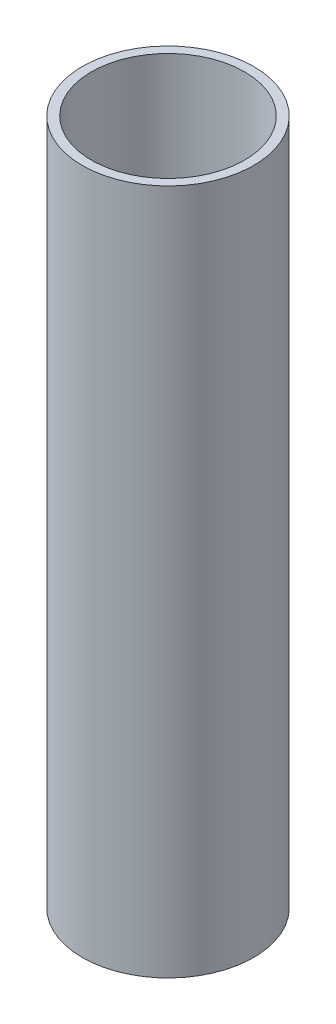
from build123d import *

# Parameters (mm, degrees)
SKETCH1_R           = 4.7625
SKETCH1_R_2         = 4.2545
BOSS_EXTRUDE1_DEPTH = 38.1


with BuildPart() as part:
    # Sketch1 → Boss-Extrude1 (new body)
    with BuildSketch(Plane(origin=(0, 0, 0), x_dir=(1, 0, 0), z_dir=(0, 1, 0))):
        Circle(SKETCH1_R)
        Circle(SKETCH1_R_2, mode=Mode.SUBTRACT)
    extrude(amount=BOSS_EXTRUDE1_DEPTH)


solid = part.part
